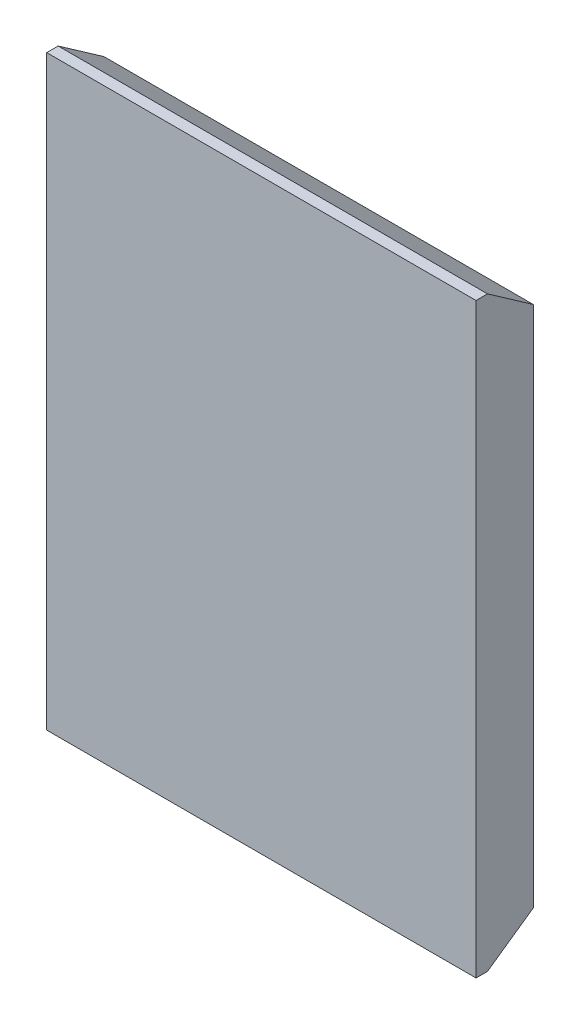
from build123d import *

# Parameters (mm, degrees)
SKETCH_1_W             = 150
SKETCH_1_H             = 205
SM_BASE_FLANGE_1_DEPTH = 20
CHAMFER_1_SIZE         = 16
CHAMFER_1_SIZE2        = 11.203320611
CHAMFER_2_SIZE         = 16
CHAMFER_2_SIZE2        = 11.203320611


# Sheet-metal steps are written as plain solids
with BuildPart() as part:
    # Sketch 1 → 基体-法兰1 (new body)
    with BuildSketch(Plane.XY):
        Rectangle(SKETCH_1_W, SKETCH_1_H)
    extrude(amount=-SM_BASE_FLANGE_1_DEPTH)

    # 倒角1
    chamfer_1_edges = [part.edges().sort_by_distance(p)[0] for p in [
        (0, 102.5, -20),
    ]]
    chamfer_1_side = [part.faces().sort_by_distance(p)[0] for p in [
        (0, 102.5, -10),
    ]]
    chamfer(chamfer_1_edges, length=CHAMFER_1_SIZE, length2=CHAMFER_1_SIZE2, reference=chamfer_1_side[0])

    # 倒角2
    chamfer_2_edges = [part.edges().sort_by_distance(p)[0] for p in [
        (0, -102.5, -20),
    ]]
    chamfer_2_side = [part.faces().sort_by_distance(p)[0] for p in [
        (0, -102.5, -10),
    ]]
    chamfer(chamfer_2_edges, length=CHAMFER_2_SIZE, length2=CHAMFER_2_SIZE2, reference=chamfer_2_side[0])


solid = part.part
